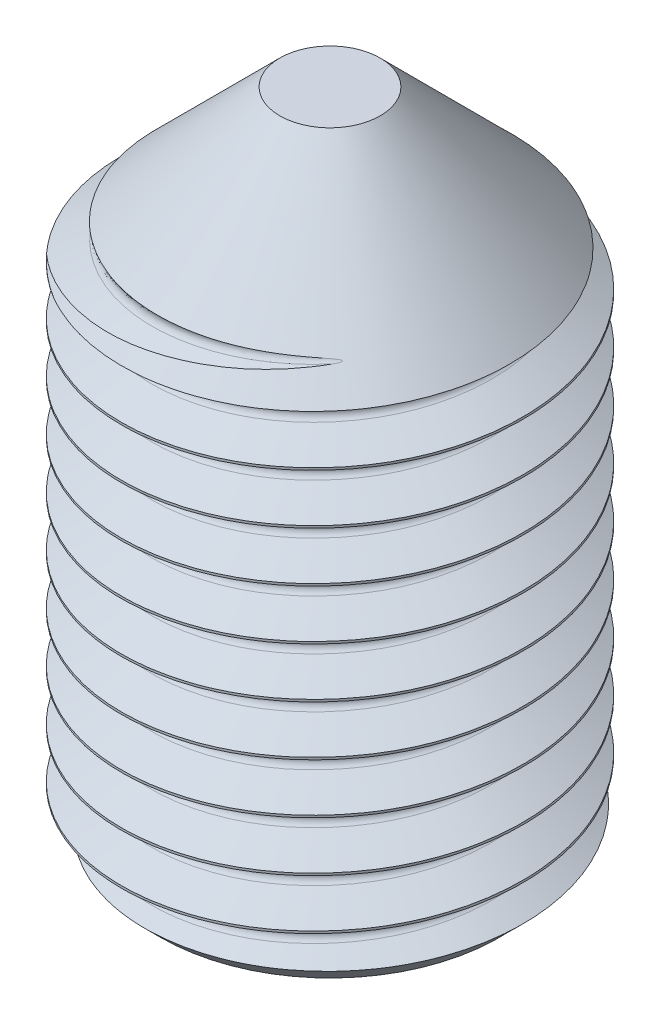
from build123d import *

# Parameters (mm, degrees)
SKETCH1_R           = 8
BOSS_EXTRUDE1_DEPTH = 13
CUT_EXTRUDE1_DEPTH  = 8
CUT_SWEEP1_PITCH    = 2


with BuildPart() as part:
    # Sketch1 → Boss-Extrude1 (new, symmetric)
    with BuildSketch(Plane(origin=(0, 0, 0), x_dir=(1, 0, 0), z_dir=(0, 1, 0))):
        with Locations(Location((0, 0, 0), (0, 0, 90))):
            Circle(SKETCH1_R)
    extrude(amount=BOSS_EXTRUDE1_DEPTH, both=True)

    # Sketch2 → Cut-Revolve1 (revolve, cut)
    with BuildSketch(Plane.XY, mode=Mode.PRIVATE) as cut_revolve1_sk:
        Polygon((2, 13), (13.60821077, 1.39178923), (13.60821077, -6.14178923), (6.75, -13), (6.75, -17.751750422), (25.879234672, -17.751750422), (25.879234672, 20.863969767), (2, 20.863969767), align=None)
    revolve(cut_revolve1_sk.sketch.rotate(Axis((0, 0, 0), (0, -1, 0)), 270), axis=Axis((0, 0, 0), (0, -1, 0)), mode=Mode.SUBTRACT)

    # Sketch3 → Cut-Extrude1 (cut)
    with BuildSketch(Plane.XZ.offset(13)):
        Polygon((4.085, -2.35847585), (4.085, 2.35847585), (0, 4.716951699), (-4.085, 2.35847585), (-4.085, -2.35847585), (0, -4.716951699), align=None)
    extrude(amount=-CUT_EXTRUDE1_DEPTH, mode=Mode.SUBTRACT)

    # Cut-Sweep1: the profile of Sketch5 screwed along a right-hand helix of 14.5 turns, 10 arcs to a turn; built about Z, then put on its axis
    cut_sweep1_z = Axis((0, 0, 0), (0, 0, 1))
    cut_sweep1_corners = [(-8.06739077, 0, 0.714418318), (-6.776900216, 0, -0.03064675), (-6.632600216, 0, -0.280581682), (-6.776900216, 0, -0.530516613), (-8.06739077, 0, -1.275581682)]
    with BuildLine(mode=Mode.PRIVATE) as cut_sweep1_profile:
        Line(cut_sweep1_corners[0], cut_sweep1_corners[1])
        Line(cut_sweep1_corners[3], cut_sweep1_corners[4])
        Line(cut_sweep1_corners[4], cut_sweep1_corners[0])
        ThreePointArc((-6.776900216, 0, -0.03064675), (-6.671265285, 0, -0.136281682), (-6.632600216, 0, -0.280581682))
        ThreePointArc((-6.632600216, 0, -0.280581682), (-6.671265285, 0, -0.424881682), (-6.776900216, 0, -0.530516613))
    cut_sweep1_cap = Face(cut_sweep1_profile.wire())
    cut_sweep1_arcs = [((-6.776900216, 0, -0.03064675), (-6.632600216, 0, -0.113958394), (-6.632600216, 0, -0.280581682), (1, 0.8660254037844375, 1)), ((-6.632600216, 0, -0.280581682), (-6.632600216, 0, -0.44720497), (-6.776900216, 0, -0.530516613), (1, 0.8660254037844375, 1))]  # start, shoulder, end, weights
    cut_sweep1_turn_angles = [0, 18, 36, 54, 72, 90, 108, 126, 144, 162, 180, 198, 216, 234, 252, 270, 288, 306, 324, 342, 360]
    cut_sweep1_turn_weights = [1, 0.9510565162951535, 1, 0.9510565162951535, 1, 0.9510565162951535, 1, 0.9510565162951535, 1, 0.9510565162951535, 1, 0.9510565162951535, 1, 0.9510565162951535, 1, 0.9510565162951535, 1, 0.9510565162951535, 1, 0.9510565162951535, 1]
    cut_sweep1_turn_rails = [Edge.make_bspline([Vector(p[0], p[1], 0).rotate(cut_sweep1_z, cut_sweep1_turn_angles[k]) / cut_sweep1_turn_weights[k] + Vector(0, 0, p[2] + CUT_SWEEP1_PITCH * cut_sweep1_turn_angles[k] / 360) for k in range(21)], [0, 0, 0, 1, 1, 2, 2, 3, 3, 4, 4, 5, 5, 6, 6, 7, 7, 8, 8, 9, 9, 10, 10, 10], 2, cut_sweep1_turn_weights) for p in cut_sweep1_corners]
    cut_sweep1_turn_sides = [*[Face.make_surface_from_curves(cut_sweep1_turn_rails[p[0]], cut_sweep1_turn_rails[p[1]]) for p in [(0, 1), (3, 4), (4, 0)]], *[Face.make_bezier_surface([[Vector(p[j][0], p[j][1], 0).rotate(cut_sweep1_z, cut_sweep1_turn_angles[2 * i + k]) / cut_sweep1_turn_weights[2 * i + k] + Vector(0, 0, p[j][2] + CUT_SWEEP1_PITCH * cut_sweep1_turn_angles[2 * i + k] / 360) for k in range(3)] for j in range(3)], [[p[3][j] * cut_sweep1_turn_weights[2 * i + k] for k in range(3)] for j in range(3)]) for p in cut_sweep1_arcs for i in range(10)]]
    cut_sweep1_last_angles = [5040, 5058, 5076, 5094, 5112, 5130, 5148, 5166, 5184, 5202, 5220]
    cut_sweep1_last_weights = [1, 0.9510565162951535, 1, 0.9510565162951535, 1, 0.9510565162951535, 1, 0.9510565162951535, 1, 0.9510565162951241, 1]
    cut_sweep1_last_rails = [Edge.make_bspline([Vector(p[0], p[1], 0).rotate(cut_sweep1_z, cut_sweep1_last_angles[k]) / cut_sweep1_last_weights[k] + Vector(0, 0, p[2] + CUT_SWEEP1_PITCH * cut_sweep1_last_angles[k] / 360) for k in range(11)], [0, 0, 0, 1, 1, 2, 2, 3, 3, 4, 4, 5, 5, 5], 2, cut_sweep1_last_weights) for p in cut_sweep1_corners]
    cut_sweep1_last_sides = [*[Face.make_surface_from_curves(cut_sweep1_last_rails[p[0]], cut_sweep1_last_rails[p[1]]) for p in [(0, 1), (3, 4), (4, 0)]], *[Face.make_bezier_surface([[Vector(p[j][0], p[j][1], 0).rotate(cut_sweep1_z, cut_sweep1_last_angles[2 * i + k]) / cut_sweep1_last_weights[2 * i + k] + Vector(0, 0, p[j][2] + CUT_SWEEP1_PITCH * cut_sweep1_last_angles[2 * i + k] / 360) for k in range(3)] for j in range(3)], [[p[3][j] * cut_sweep1_last_weights[2 * i + k] for k in range(3)] for j in range(3)]) for p in cut_sweep1_arcs for i in range(5)]]
    cut_sweep1 = Plane(origin=(0, -13, 0), x_dir=(-1, 0, 0), z_dir=(0, 1, 0)) * Solid(Shell([*[p.moved(Location((0, 0, CUT_SWEEP1_PITCH * i))) for i in range(14) for p in cut_sweep1_turn_sides], *cut_sweep1_last_sides, cut_sweep1_cap, cut_sweep1_cap.rotate(cut_sweep1_z, 5220).moved(Location((0, 0, CUT_SWEEP1_PITCH * 5220 / 360)))]))
    add(cut_sweep1, mode=Mode.SUBTRACT)

    # Cut-Extrude2 cone 1 section (through the dimple's axis) → Cut-Extrude2 (revolve, cut)
    with BuildSketch(Plane(origin=(0, -13, 0), x_dir=(0, 0, -1), z_dir=(1, 0, 0))):
        Polygon((0, 0), (4.716951699, 0), (0, 1.263903399), align=None)
    revolve(axis=Axis((0, -13, 0), (0, 1, 0)), mode=Mode.SUBTRACT)


solid = part.part
